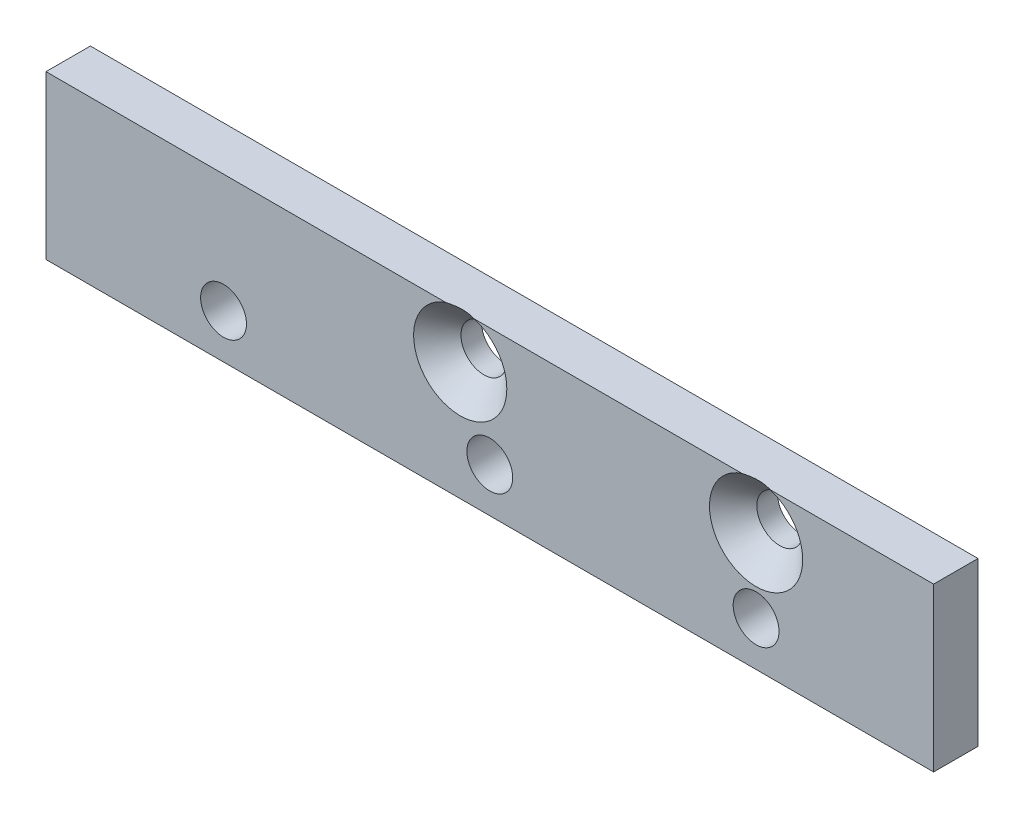
from build123d import *

# Parameters (mm, degrees)
SKETCH_1_W      = 60
SKETCH_1_H      = 11
SKETCH_1_R      = 1.55
EXTRUDE_1_DEPTH = 3
CHAMFER_1_SIZE  = 1.6


with BuildPart() as part:
    # 草图1 → 凸台-拉伸1 (new body)
    with BuildSketch(Plane.XY):
        Rectangle(SKETCH_1_W, SKETCH_1_H)
        with Locations((18, 2.5)):
            Circle(SKETCH_1_R, mode=Mode.SUBTRACT)
        with Locations((-2, 2.5)):
            Circle(SKETCH_1_R, mode=Mode.SUBTRACT)
        with Locations((0, -2.5)):
            Circle(SKETCH_1_R, mode=Mode.SUBTRACT)
        with Locations((18, -2.5)):
            Circle(SKETCH_1_R, mode=Mode.SUBTRACT)
        with Locations((-18, -2.5)):
            Circle(SKETCH_1_R, mode=Mode.SUBTRACT)
    extrude(amount=EXTRUDE_1_DEPTH)

    # 倒角1
    # the kernel refuses this chamfer: 1.6 mm, written as the material it takes off along each edge
    with BuildSketch(Plane(origin=(18, 2.5, 3), x_dir=(1, 0, 0), z_dir=(0, -1, 0))) as chamfer_1_piece_1:
        Polygon((1.55, -CHAMFER_1_SIZE), (1.55 + CHAMFER_1_SIZE, 0), (1.55, 0), align=None)
    revolve(axis=Axis((18, 2.5, 3), (0, 0, 1)), mode=Mode.SUBTRACT)
    with BuildSketch(Plane(origin=(-2, 2.5, 3), x_dir=(1, 0, 0), z_dir=(0, -1, 0))) as chamfer_1_piece_2:
        Polygon((1.55, -CHAMFER_1_SIZE), (1.55 + CHAMFER_1_SIZE, 0), (1.55, 0), align=None)
    revolve(axis=Axis((-2, 2.5, 3), (0, 0, 1)), mode=Mode.SUBTRACT)


solid = part.part
